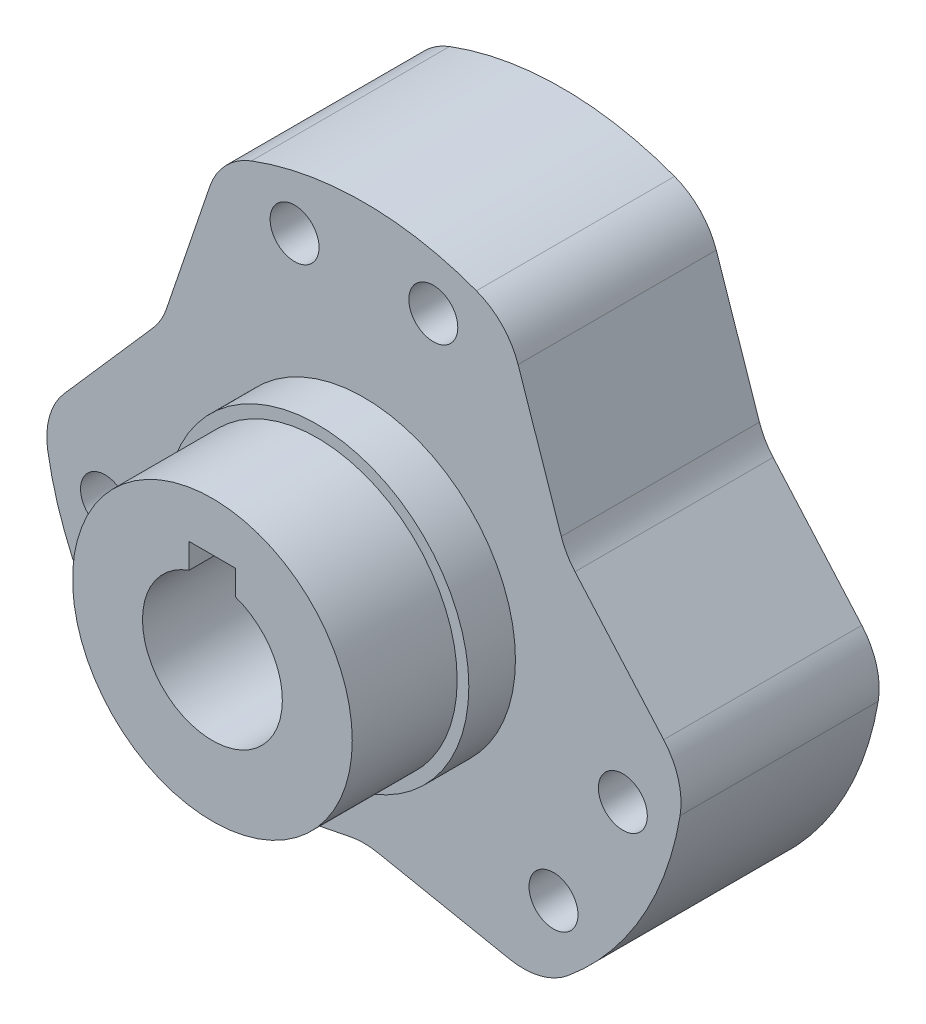
from build123d import *

# Parameters (mm, degrees)
SKETCH_1_R                       = 27.5
EXTRUDE_1_DEPTH                  = 17
SKETCH_2_R                       = 13
EXTRUDE_2_DEPTH                  = 4
EXTRUDE_START                    = 4
SKETCH_3_R                       = 13
EXTRUDE_3_DEPTH                  = 4
HOLE_WIZARD_M5_1_D               = 4.2
CUT_EXTRUDE_4_DEPTH              = 45.198416261
FILLET_1_R                       = 6
PATTERN_CIRCULAR_1_COUNT         = 2
PATTERN_CIRCULAR_1_ANGLE         = 120
FILLET_1_OF_PATTERN_CIRCULAR_1_R = 6
PATTERN_CIRCULAR_2_DEPTH         = 17
PATTERN_CIRCULAR_3_COUNT         = 3
SKETCH_15_R                      = 12
EXTRUDE_4_DEPTH                  = 9
SKETCH_16_R                      = 6
CUT_EXTRUDE_5_DEPTH              = 34
SKETCH_17_W                      = 4
SKETCH_17_H                      = 2.143145751
CUT_EXTRUDE_6_DEPTH              = 34


# Read off the part's stored shape, not the designer's step: 阵列(圆周)2
with BuildPart() as part:
    # 草图1 → 凸台-拉伸1 (new body)
    with BuildSketch(Plane.XY):
        Circle(SKETCH_1_R)
    extrude(amount=EXTRUDE_1_DEPTH)

    # 草图2 → 凸台-拉伸2 (add)
    with BuildSketch(Plane(origin=(0, 0, 0), x_dir=(-1, 0, 0), z_dir=(0, 0, -1))):
        with Locations(Location((0, 0, 0), (0, 0, 180))):
            Circle(SKETCH_2_R)
    extrude(amount=EXTRUDE_2_DEPTH)

    # 草图3 → 凸台-拉伸3 (add)
    with BuildSketch(Plane.XY.offset(17).offset(EXTRUDE_START)):
        Circle(SKETCH_3_R)
    extrude(amount=-EXTRUDE_3_DEPTH)

    # M5 螺纹孔1 (through all)
    with Locations(Plane(origin=(16.263455967, -16.263455967, 17), x_dir=(1, 0, 0), z_dir=(0, 0, 1))):
        with Locations((0, 0), (5.952838038, 10.31061793)):
            hole_wizard_m5_1 = Hole(HOLE_WIZARD_M5_1_D / 2)

    # 草图14 → 切除-拉伸4 (cut, through all)
    with BuildSketch(Plane.XY.offset(17)):
        Polygon((0, -23), (0, -20), (-15.074813432, -23), align=None)
        Polygon((15.074813432, -23), (0, -20), (0, -23), align=None)
        with BuildLine():
            Line((15.074813432, -23), (0, -23))
            Line((0, -23), (-15.074813432, -23))
            ThreePointArc((-15.074813432, -23), (0, -27.5), (15.074813432, -23))
        make_face()
    cut_extrude_4 = extrude(amount=-CUT_EXTRUDE_4_DEPTH, mode=Mode.SUBTRACT)

    # 圆角1
    fillet_1_edges = [part.edges().sort_by_distance(p)[0] for p in [
        (15.074813432, -23, 8.5),
        (-15.074813432, -23, 8.5),
        (0, -20, 8.5),
    ]]
    fillet(fillet_1_edges, radius=FILLET_1_R)

    # 阵列(圆周)1: 切除-拉伸4 ×2 about axis
    pattern_circular_1_axis = Axis((0, 0, 0), (0, 0, 1))
    for i in range(1, PATTERN_CIRCULAR_1_COUNT):
        add(cut_extrude_4.rotate(pattern_circular_1_axis, i * PATTERN_CIRCULAR_1_ANGLE / (PATTERN_CIRCULAR_1_COUNT - 1)), mode=Mode.SUBTRACT)

    # 圆角1 of 阵列(圆周)1
    fillet_1_of_pattern_circular_1_edges = [part.edges().sort_by_distance(p)[0] for p in [
        (12.381177571, 24.555171389, 8.5),
        (27.455991003, -1.555171389, 8.5),
        (17.320508076, 10, 8.5),
    ]]
    fillet(fillet_1_of_pattern_circular_1_edges, radius=FILLET_1_OF_PATTERN_CIRCULAR_1_R)

    # 阵列(圆周)2 outline → 阵列(圆周)2 (cut)
    with BuildSketch(Plane.XY):
        with BuildLine():
            Line((-16.936798412, 11.13071193), (-13.227796767, 22.060362126))
            ThreePointArc((-13.227796767, 22.060362126), (-11.854885653, 24.30763066), (-9.651911166, 25.750545836))
            ThreePointArc((-9.651911166, 25.750545836), (-23.815698604, 13.75), (-27.126582438, -4.516472653))
            ThreePointArc((-27.126582438, -4.516472653), (-26.978468484, -1.887183196), (-25.718732401, 0.425426973))
            Line((-25.718732401, 0.425426973), (-18.107878499, 9.102341718))
            ThreePointArc((-18.107878499, 9.102341718), (-17.422403117, 10.05882913), (-16.936798412, 11.13071193))
        make_face()
    extrude(amount=PATTERN_CIRCULAR_2_DEPTH, mode=Mode.SUBTRACT)

    # 阵列(圆周)3: M5 螺纹孔1 ×3 about axis
    pattern_circular_3_axis = Axis((0, 0, 0), (0, 0, 1))
    for i in range(1, PATTERN_CIRCULAR_3_COUNT):
        add(hole_wizard_m5_1.rotate(pattern_circular_3_axis, i * 360 / PATTERN_CIRCULAR_3_COUNT), mode=Mode.SUBTRACT)

    # 草图15 → 凸台-拉伸4 (add)
    with BuildSketch(Plane.XY.offset(21)):
        Circle(SKETCH_15_R)
    extrude(amount=EXTRUDE_4_DEPTH)

    # 草图16 → 切除-拉伸5 (cut)
    with BuildSketch(Plane.XY.offset(30)):
        Circle(SKETCH_16_R)
    extrude(amount=-CUT_EXTRUDE_5_DEPTH, mode=Mode.SUBTRACT)

    # 草图17 → 切除-拉伸6 (cut)
    with BuildSketch(Plane.XY.offset(30)):
        with Locations((0, 6.728427125)):
            Rectangle(SKETCH_17_W, SKETCH_17_H)
    extrude(amount=-CUT_EXTRUDE_6_DEPTH, mode=Mode.SUBTRACT)


solid = part.part
